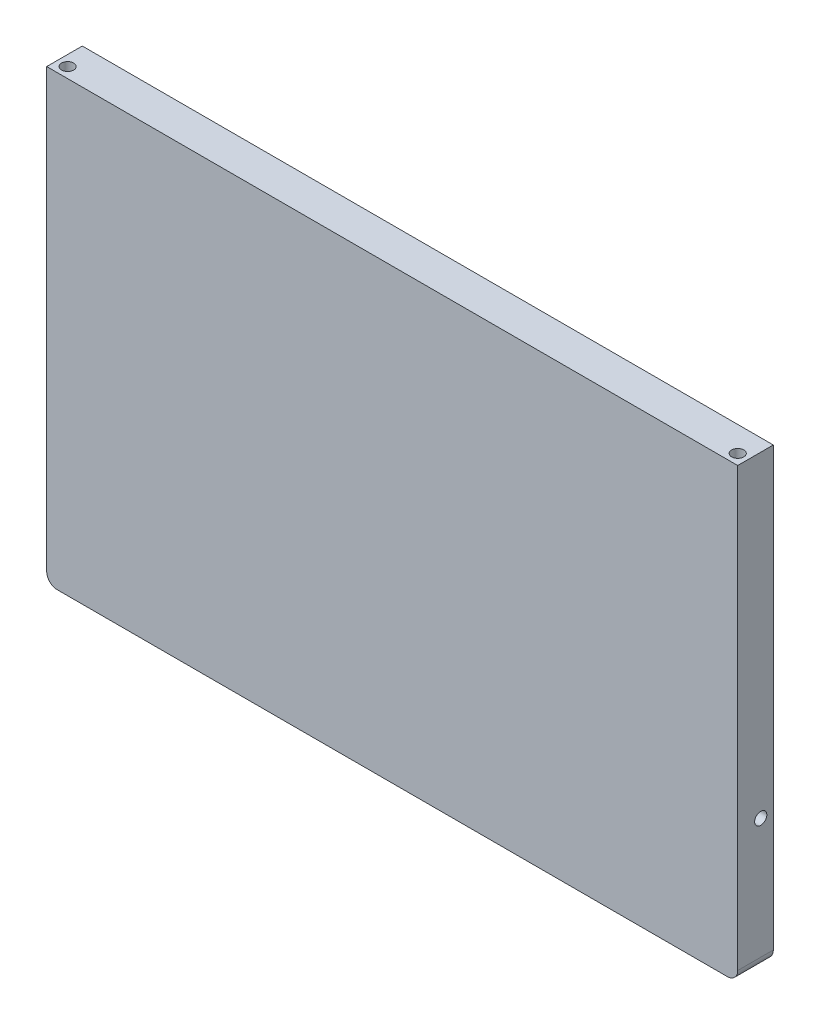
from build123d import *

# Parameters (mm, degrees)
SKETCH1_W           = 165.1
SKETCH1_H           = 90
BOSS_EXTRUDE1_DEPTH = 5
SKETCH2_R           = 1.45
CUT_EXTRUDE1_DEPTH  = 7
SKETCH4_W           = 165.1
SKETCH4_H           = 90
BOSS_EXTRUDE2_DEPTH = 3.5
SKETCH8_R           = 1.45
CUT_EXTRUDE5_DEPTH  = 3
SKETCH10_W          = 165.1
SKETCH10_H          = 8.5
BOSS_EXTRUDE4_DEPTH = 17
FILLET1_R           = 2.5
SKETCH11_W          = 103.4
SKETCH11_H          = 90.9
CUT_EXTRUDE6_DEPTH  = 6


with BuildPart() as part:
    # Sketch1 → Boss-Extrude1 (new body)
    with BuildSketch(Plane.XY):
        with Locations((0, -35.801949153)):
            Rectangle(SKETCH1_W, SKETCH1_H)
    extrude(amount=BOSS_EXTRUDE1_DEPTH)

    # Sketch2 → Cut-Extrude1 (cut)
    with BuildSketch(Plane(origin=(0, 9.198050847, 0), x_dir=(1, 0, 0), z_dir=(0, 1, 0))):
        with Locations((-80.05, -2.5)):
            Circle(SKETCH2_R)
        with Locations((80.05, -2.5)):
            Circle(SKETCH2_R)
    extrude(amount=-CUT_EXTRUDE1_DEPTH, mode=Mode.SUBTRACT)

    # Sketch4 → Boss-Extrude2 (add)
    with BuildSketch(Plane(origin=(0, 0, 0), x_dir=(-1, 0, 0), z_dir=(0, 0, -1))):
        with Locations((0, -35.801949153)):
            Rectangle(SKETCH4_W, SKETCH4_H)
    extrude(amount=BOSS_EXTRUDE2_DEPTH)

    # Sketch8 → Cut-Extrude5 (cut)
    with BuildSketch(Plane(origin=(82.55, 0, 0), x_dir=(0, 0, -1), z_dir=(1, 0, 0))):
        with Locations((0.5, -66.551949153)):
            Circle(SKETCH8_R)
    cut_extrude5 = extrude(amount=-CUT_EXTRUDE5_DEPTH, mode=Mode.SUBTRACT)

    # Mirror2: Cut-Extrude5 across plane
    add(cut_extrude5.mirror(Plane(origin=(0, 0, 0), x_dir=(0, 0, 1), z_dir=(1, 0, 0))), mode=Mode.SUBTRACT)

    # Sketch10 → Boss-Extrude4 (add)
    with BuildSketch(Plane.XZ.offset(80.801949153)):
        with Locations((0, 0.75)):
            Rectangle(SKETCH10_W, SKETCH10_H)
    extrude(amount=BOSS_EXTRUDE4_DEPTH)

    # Fillet1
    fillet1_edges = [part.edges().sort_by_distance(p)[0] for p in [
        (82.55, -97.801949153, 0.75),
        (-82.55, -97.801949153, 0.75),
    ]]
    fillet(fillet1_edges, radius=FILLET1_R)

    # Sketch11 → Cut-Extrude6 (cut)
    with BuildSketch(Plane(origin=(0, 0, -3.5), x_dir=(-1, 0, 0), z_dir=(0, 0, -1))):
        with Locations((0, -43.051949153)):
            Rectangle(SKETCH11_W, SKETCH11_H)
    extrude(amount=-CUT_EXTRUDE6_DEPTH, mode=Mode.SUBTRACT)


solid = part.part
